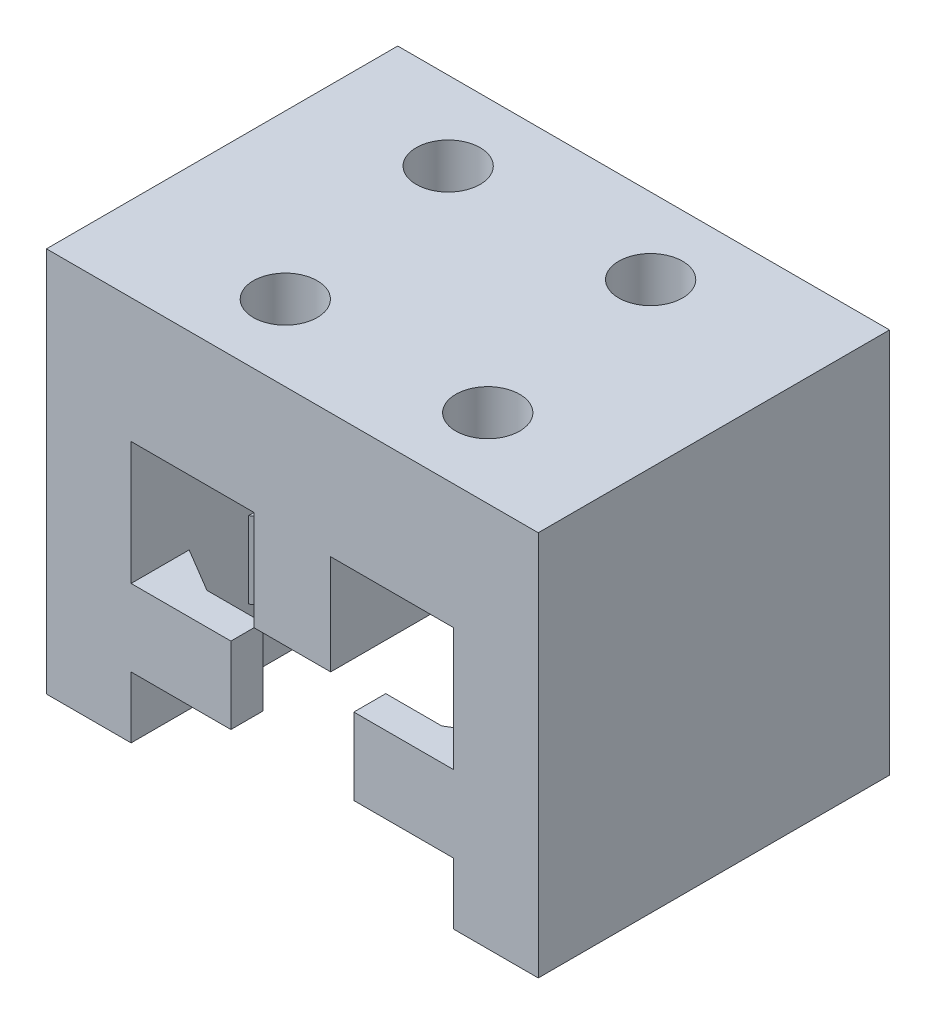
from build123d import *

# Parameters (mm, degrees)
ESQUISSE1_W                   = 30.8
ESQUISSE1_H                   = 24.15
BOSS_EXTRU_1_DEPTH            = 22
ENL_V_START                   = -22
ENL_V_MAT_EXTRU_2_DEPTH       = 22
ENL_V_MAT_EXTRU_14_DEPTH      = 47.950397903
ENL_V_MAT_EXTRU_14_DEPTH_BACK = 4.8
ENL_V_MAT_EXTRU_19_DEPTH      = 4.8
ENL_V_MAT_EXTRU_20_DEPTH      = 4.8
ENL_V_MAT_EXTRU_21_DEPTH      = 4.8
ESQUISSE17_R                  = 2
ENL_V_MAT_EXTRU_22_DEPTH      = 4.4
ESQUISSE18_R                  = 3
ENL_V_MAT_EXTRU_24_DEPTH      = 3.4
ESQUISSE19_R                  = 3
ENL_V_MAT_EXTRU_29_DEPTH      = 3.4
ESQUISSE22_R                  = 3
ENL_V_MAT_EXTRU_30_DEPTH      = 3.4
ESQUISSE23_R                  = 3
ENL_V_MAT_EXTRU_31_DEPTH      = 3.4


# Read off the part's stored shape, not the designer's step: Enlèv. mat.-Extru.2
with BuildPart() as part:
    # Esquisse1 → Boss.-Extru.1 (new body)
    with BuildSketch(Plane.XY):
        with Locations((-20.769736842, 6.111184211)):
            Rectangle(ESQUISSE1_W, ESQUISSE1_H)
    extrude(amount=BOSS_EXTRU_1_DEPTH)

    # Enlèv. mat.-Extru.2 outline → Enlèv. mat.-Extru.2 (cut)
    with BuildSketch(Plane.XY.offset(22).offset(ENL_V_START)):
        Polygon((-30.869736842, -5.963815789), (-10.669736842, -5.963815789), (-10.669736842, -2.113815789), (-16.919736842, -2.113815789), (-16.919736842, 2.686184211), (-10.669736842, 2.686184211), (-10.669736842, 10.386184211), (-18.369736842, 10.386184211), (-18.369736842, 4.136184211), (-23.169736842, 4.136184211), (-23.169736842, 10.386184211), (-30.869736842, 10.386184211), (-30.869736842, 2.686184211), (-24.619736842, 2.686184211), (-24.619736842, -2.113815789), (-30.869736842, -2.113815789), align=None)
    extrude(amount=ENL_V_MAT_EXTRU_2_DEPTH, mode=Mode.SUBTRACT)

    # Esquisse12 → Enlèv. mat.-Extru.14 (cut, two sides: drawn at the far end of the back side and taken through both)
    with BuildSketch(Plane(origin=(0, -2.113815789, 0), x_dir=(-1, 0, 0), z_dir=(0, -1, 0)).offset(-ENL_V_MAT_EXTRU_14_DEPTH_BACK)):
        Polygon((16.919736842, -9), (16.919736842, -2), (13.419736842, -2), (10.669736842, -3.636306817), (10.669736842, -7.363693183), (13.419736842, -9), align=None)
    extrude(amount=ENL_V_MAT_EXTRU_14_DEPTH + ENL_V_MAT_EXTRU_14_DEPTH_BACK, mode=Mode.SUBTRACT)

    # Esquisse13 → Enlèv. mat.-Extru.19 (cut)
    with BuildSketch(Plane(origin=(0, -2.113815789, 0), x_dir=(-1, 0, 0), z_dir=(0, -1, 0))):
        Polygon((24.619736842, -2), (28.119736842, -2), (30.869736842, -3.636306817), (30.869736842, -7.363693183), (28.119736842, -9), (24.619736842, -9), align=None)
    extrude(amount=-ENL_V_MAT_EXTRU_19_DEPTH, mode=Mode.SUBTRACT)

    # Esquisse14 → Enlèv. mat.-Extru.20 (cut)
    with BuildSketch(Plane(origin=(0, -2.113815789, 0), x_dir=(-1, 0, 0), z_dir=(0, -1, 0))):
        Polygon((24.619736842, -20), (28.119736842, -20), (30.869736842, -18.363693183), (30.869736842, -14.636306817), (28.119736842, -13), (24.619736842, -13), align=None)
    extrude(amount=-ENL_V_MAT_EXTRU_20_DEPTH, mode=Mode.SUBTRACT)

    # Esquisse16 → Enlèv. mat.-Extru.21 (cut)
    with BuildSketch(Plane(origin=(0, -2.113815789, 0), x_dir=(-1, 0, 0), z_dir=(0, -1, 0))):
        Polygon((16.919736842, -20), (13.419736842, -20), (10.669736842, -18.363693183), (10.669736842, -14.636306817), (13.419736842, -13), (16.919736842, -13), align=None)
    extrude(amount=-ENL_V_MAT_EXTRU_21_DEPTH, mode=Mode.SUBTRACT)

    # Esquisse17 → Enlèv. mat.-Extru.22 (cut)
    with BuildSketch(Plane(origin=(0, 18.186184211, 0), x_dir=(1, 0, 0), z_dir=(0, 1, 0))):
        with Locations(Location((-15.581044692, -4.75, 0), (0, 0, 270))):
            Circle(ESQUISSE17_R)
        with Locations(Location((-13.462622288, -17.069183679, 0), (0, 0, 270))):
            Circle(ESQUISSE17_R)
        with Locations(Location((-25.961314438, -17.25, 0), (0, 0, 270))):
            Circle(ESQUISSE17_R)
        with Locations(Location((-28.079736842, -4.930816321, 0), (0, 0, 270))):
            Circle(ESQUISSE17_R)
    extrude(amount=-ENL_V_MAT_EXTRU_22_DEPTH, mode=Mode.SUBTRACT)

    # Esquisse18 → Enlèv. mat.-Extru.24 (cut)
    with BuildSketch(Plane(origin=(0, 13.786184211, 0), x_dir=(1, 0, 0), z_dir=(0, 1, 0))):
        with Locations(Location((-28.079736842, -4.930816321, 0), (0, 0, 270))):
            Circle(ESQUISSE18_R)
    extrude(amount=-ENL_V_MAT_EXTRU_24_DEPTH, mode=Mode.SUBTRACT)

    # Esquisse19 → Enlèv. mat.-Extru.29 (cut)
    with BuildSketch(Plane(origin=(0, 13.786184211, 0), x_dir=(1, 0, 0), z_dir=(0, 1, 0))):
        with Locations(Location((-25.961314438, -17.25, 0), (0, 0, 270))):
            Circle(ESQUISSE19_R)
    extrude(amount=-ENL_V_MAT_EXTRU_29_DEPTH, mode=Mode.SUBTRACT)

    # Esquisse22 → Enlèv. mat.-Extru.30 (cut)
    with BuildSketch(Plane(origin=(0, 13.786184211, 0), x_dir=(1, 0, 0), z_dir=(0, 1, 0))):
        with Locations(Location((-15.581044692, -4.75, 0), (0, 0, 270))):
            Circle(ESQUISSE22_R)
    extrude(amount=-ENL_V_MAT_EXTRU_30_DEPTH, mode=Mode.SUBTRACT)

    # Esquisse23 → Enlèv. mat.-Extru.31 (cut)
    with BuildSketch(Plane(origin=(0, 13.786184211, 0), x_dir=(1, 0, 0), z_dir=(0, 1, 0))):
        with Locations(Location((-13.462622288, -17.069183679, 0), (0, 0, 270))):
            Circle(ESQUISSE23_R)
    extrude(amount=-ENL_V_MAT_EXTRU_31_DEPTH, mode=Mode.SUBTRACT)


solid = part.part
